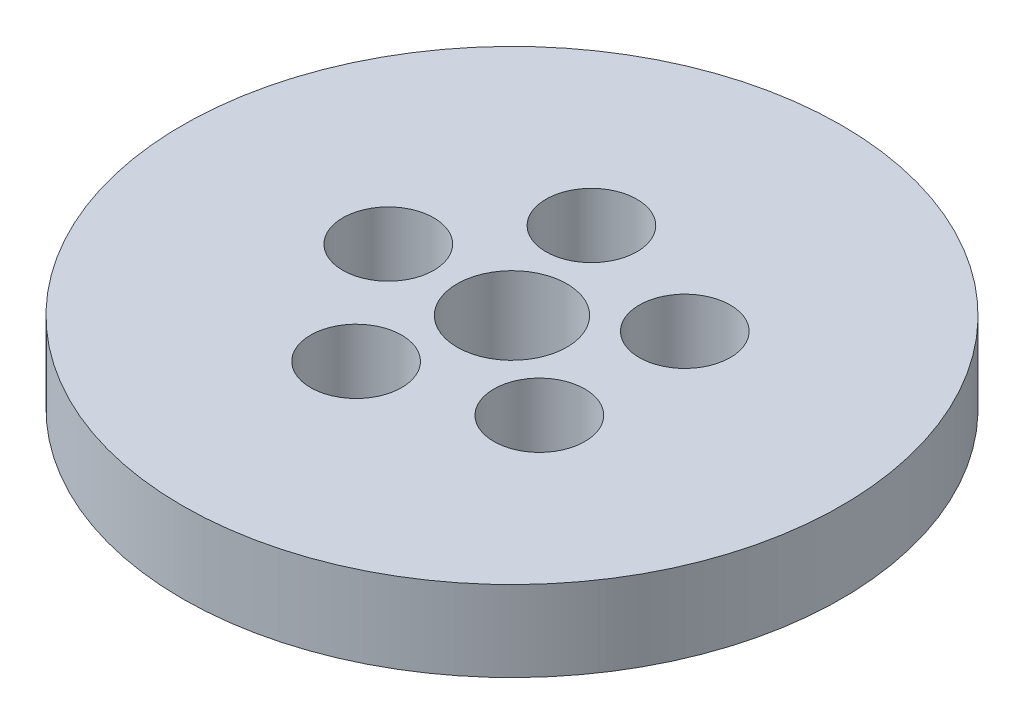
from build123d import *

# Parameters (mm, degrees)
SKETCH1_R           = 45
BOSS_EXTRUDE1_DEPTH = 11
SKETCH2_R           = 7.5
CUT_EXTRUDE1_DEPTH  = 65.58327957
SKETCH3_R           = 6.217652309
CUT_EXTRUDE2_DEPTH  = 10.602135451
CIRPATTERN1_COUNT   = 5


with BuildPart() as part:
    # Sketch1 → Boss-Extrude1 (new body)
    with BuildSketch(Plane(origin=(0, 0, 0), x_dir=(1, 0, 0), z_dir=(0, 1, 0))):
        Circle(SKETCH1_R)
    extrude(amount=BOSS_EXTRUDE1_DEPTH)

    # Sketch2 → Cut-Extrude1 (cut, through all)
    with BuildSketch(Plane(origin=(0, 0, 0), x_dir=(1, 0, 0), z_dir=(0, 1, 0))):
        Circle(SKETCH2_R)
    extrude(amount=CUT_EXTRUDE1_DEPTH, mode=Mode.SUBTRACT)

    # Sketch3 → Cut-Extrude2 (cut)
    with BuildSketch(Plane(origin=(0, 11, 0), x_dir=(1, 0, 0), z_dir=(0, 1, 0))):
        with Locations((-16.892587614, 0)):
            Circle(SKETCH3_R)
    cut_extrude2 = extrude(amount=-CUT_EXTRUDE2_DEPTH, mode=Mode.SUBTRACT)

    # CirPattern1: Cut-Extrude2 ×5 about axis
    cirpattern1_axis = Axis((0, 0, 0), (0, 1, 0))
    for i in range(1, CIRPATTERN1_COUNT):
        add(cut_extrude2.rotate(cirpattern1_axis, i * 360 / CIRPATTERN1_COUNT), mode=Mode.SUBTRACT)


solid = part.part
